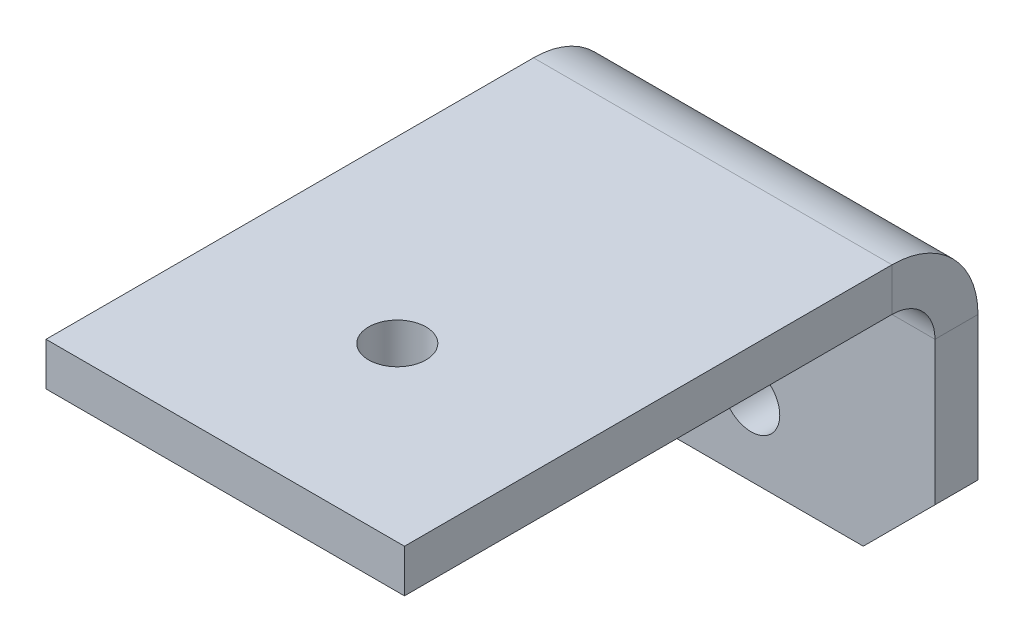
from build123d import *

# Parameters (mm, degrees)
SKETCH1_W                 = 25
SKETCH1_H                 = 15
SKETCH1_R                 = 2
BASE_FLANGE1_DEPTH        = 3
EDGE_FLANGE1_DEPTH        = 25
EDGE_FLANGE1_START        = 3
EDGE_FLANGE1_PROFILE_W    = 25
EDGE_FLANGE1_PROFILE_H    = 34
EDGE_FLANGE1_PROFILE_R    = 2
EDGE_FLANGE1_FLAT_DEPTH   = 3
BREAK_CORNER1_START       = -12.712257412
BREAK_CORNER1_OUTLINE_W   = 19.637623744
BREAK_CORNER1_OUTLINE_H   = 3
BREAK_CORNER1_DEPTH       = 3.535533905
BREAK_CORNER1_START_2     = 1.429878211
BREAK_CORNER1_2_OUTLINE_W = 4.362376256
BREAK_CORNER1_2_OUTLINE_H = 3
BREAK_CORNER1_2_DEPTH     = 7.071067812


# Read off the part's stored shape, not the designer's step: Break-Corner1
# Sheet-metal steps are written as plain solids
with BuildPart() as part:
    # Sketch1 → Base-Flange1 (new body)
    with BuildSketch(Plane.XY):
        with Locations((0.325905683, 1.696247476)):
            Rectangle(SKETCH1_W, SKETCH1_H)
        with Locations((0, -0.803752524)):
            Circle(SKETCH1_R, mode=Mode.SUBTRACT)
    extrude(amount=-BASE_FLANGE1_DEPTH)

    # Edge-Flange1 bend section (across the edge) → Edge-Flange1 (add)
    with BuildSketch(Plane(origin=(12.825905683, 12.196247476, 0), x_dir=(0, -1, 0), z_dir=(-1, 0, 0))):
        with BuildLine():
            Line((-3, 3), (0, 3))
            ThreePointArc((0, 3), (0.878679656, 0.878679656), (3, 0))
            Line((3, 0), (3, -3))
            ThreePointArc((3, -3), (-1.242640687, -1.242640687), (-3, 3))
        make_face()
    extrude(amount=EDGE_FLANGE1_DEPTH)

    # Edge-Flange1 profile (on flange) → Edge-Flange1 flat (add)
    with BuildSketch(Plane(origin=(0, 12.196247476, 0), x_dir=(-1, 0, 0), z_dir=(0, 1, 0)).offset(EDGE_FLANGE1_START)):
        with Locations((-0.325905683, 20)):
            Rectangle(EDGE_FLANGE1_PROFILE_W, EDGE_FLANGE1_PROFILE_H)
        with Locations((-0.325905683, 25)):
            Circle(EDGE_FLANGE1_PROFILE_R, mode=Mode.SUBTRACT)
    extrude(amount=-EDGE_FLANGE1_FLAT_DEPTH)

    # Break-Corner1 outline → Break-Corner1 (cut)
    with BuildSketch(Plane(origin=(0, 0, 0), x_dir=(0.707106781186548, -0.707106781186547, 0), z_dir=(0.707106781186547, 0.707106781186548, 0)).offset(BREAK_CORNER1_START)):
        with Locations((-0.181188128, 1.5)):
            Rectangle(BREAK_CORNER1_OUTLINE_W, BREAK_CORNER1_OUTLINE_H)
    extrude(amount=BREAK_CORNER1_DEPTH, mode=Mode.SUBTRACT)

    # Break-Corner1 2 outline → Break-Corner1 2 (cut)
    with BuildSketch(Plane(origin=(0, 0, 0), x_dir=(0.707106781186548, -0.707106781186547, 0), z_dir=(0.707106781186547, 0.707106781186548, 0)).offset(BREAK_CORNER1_START_2)):
        with Locations((11.818811872, 1.5)):
            Rectangle(BREAK_CORNER1_2_OUTLINE_W, BREAK_CORNER1_2_OUTLINE_H)
    extrude(amount=BREAK_CORNER1_2_DEPTH, mode=Mode.SUBTRACT)


solid = part.part
